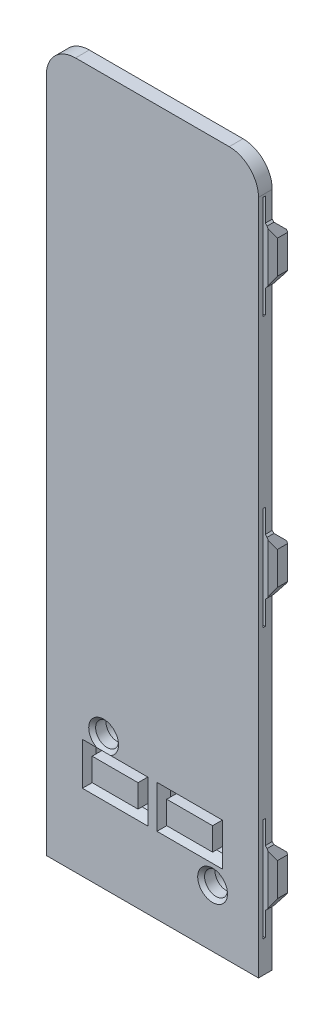
from build123d import *
from OCP.BRepFilletAPI import BRepFilletAPI_MakeChamfer

# Parameters (mm, degrees)
AUFSATZ_LINEAR_AUSTRAGEN1_DEPTH      = 1.2
SKIZZE3_W                            = 1.2
SKIZZE3_H                            = 9
SCHNITT_LINEAR_AUSTRAGEN1_DEPTH      = 0.8
SCHNITT_LINEAR_AUSTRAGEN2_REACH      = 46.284
SKIZZE4_W                            = 0.2
SKIZZE4_H                            = 9
AUFSATZ_LINEAR_AUSTRAGEN2_DEPTH      = 0.7
AUFSATZ_LINEAR_AUSTRAGEN2_DEPTH_BACK = 0.6
SKIZZE5_W                            = 1.85
SKIZZE5_H                            = 4.6
FASE3_SIZE                           = 0.4
FASE1_SIZE                           = 0.5
FASE1_SIZE2                          = 0.866025404
FASE4_SIZE                           = 0.7
FASE5_SIZE                           = 0.15
SKIZZE6_R                            = 1
SCHNITT_LINEAR_AUSTRAGEN3_DEPTH      = 90.774735305
SKIZZE7_W                            = 4
SKIZZE7_H                            = 2
AUFSATZ_LINEAR_AUSTRAGEN3_DEPTH      = 2.8
SKIZZE8_W                            = 4.5
SKIZZE8_H                            = 2.5
SKIZZE8_W_2                          = 4
SKIZZE8_H_2                          = 2
SCHNITT_LINEAR_AUSTRAGEN4_DEPTH      = 90.798291181
SKIZZE16_R                           = 1.5
SKIZZE16_R_2                         = 1.125
AUFSATZ_LINEAR_AUSTRAGEN8_DEPTH      = 2
SKIZZE17_W                           = 0.9
SKIZZE17_H                           = 5
AUFSATZ_LINEAR_AUSTRAGEN9_DEPTH      = 0.3
SKIZZE18_W                           = 0.9
SKIZZE18_H                           = 1
AUFSATZ_LINEAR_AUSTRAGEN10_DEPTH     = 0.5
FASE6_SIZE                           = 0.5
FASE7_SIZE                           = 0.3
FASE8_SIZE                           = 0.3
FASE9_SIZE                           = 0.6


# Some blends are built 0.0001 mm under size
with BuildPart() as part:
    # Skizze2 → Aufsatz-Linear austragen1 (new body)
    with BuildSketch(Plane.XY.offset(4.5)):
        with BuildLine():
            Line((-63.757544371, 39.98197296), (-77.157544371, 39.98197296))
            ThreePointArc((-77.157544371, 39.98197296), (-78.960666663, 39.235095252), (-79.707544371, 37.43197296))
            Line((-79.707544371, 37.43197296), (-79.707544371, -21.51802704))
            Line((-79.707544371, -21.51802704), (-61.207544371, -21.51802704))
            Line((-61.207544371, -21.51802704), (-61.207544371, 37.43197296))
            ThreePointArc((-61.207544371, 37.43197296), (-61.954422079, 39.235095252), (-63.757544371, 39.98197296))
        make_face()
    extrude(amount=-AUFSATZ_LINEAR_AUSTRAGEN1_DEPTH)

    # Skizze3 → Schnitt-Linear austragen1 (cut)
    with BuildSketch(Plane(origin=(0, 0, 3.3), x_dir=(-1, 0, 0), z_dir=(0, 0, -1))):
        with Locations((63.007544371, 32.73197296)):
            Rectangle(SKIZZE3_W, SKIZZE3_H)
        with Locations((63.007544371, 9.23197296)):
            Rectangle(SKIZZE3_W, SKIZZE3_H)
        with Locations((63.007544371, -14.26802704)):
            Rectangle(SKIZZE3_W, SKIZZE3_H)
        with Locations((77.907544371, -14.26802704)):
            Rectangle(SKIZZE3_W, SKIZZE3_H)
        with Locations((77.907544371, 9.23197296)):
            Rectangle(SKIZZE3_W, SKIZZE3_H)
        with Locations((77.907544371, 32.73197296)):
            Rectangle(SKIZZE3_W, SKIZZE3_H)
    extrude(amount=-SCHNITT_LINEAR_AUSTRAGEN1_DEPTH, mode=Mode.SUBTRACT)

    # Skizze4 → Schnitt-Linear austragen2 (cut, up to next)
    with BuildSketch(Plane(origin=(-61.207544371, 0, 0), x_dir=(0, 0, -1), z_dir=(1, 0, 0)), mode=Mode.PRIVATE) as schnitt_linear_austragen2_sk1:
        with Locations((-4, 32.73197296)):
            Rectangle(SKIZZE4_W, SKIZZE4_H)
    schnitt_linear_austragen2_tool1 = extrude(schnitt_linear_austragen2_sk1.sketch, amount=-SCHNITT_LINEAR_AUSTRAGEN2_REACH, mode=Mode.PRIVATE) & part.part
    # Skizze4 → Schnitt-Linear austragen2 (cut, up to next)
    with BuildSketch(Plane(origin=(-61.207544371, 0, 0), x_dir=(0, 0, -1), z_dir=(1, 0, 0)), mode=Mode.PRIVATE) as schnitt_linear_austragen2_sk2:
        with Locations((-4, 9.23197296)):
            Rectangle(SKIZZE4_W, SKIZZE4_H)
    schnitt_linear_austragen2_tool2 = extrude(schnitt_linear_austragen2_sk2.sketch, amount=-SCHNITT_LINEAR_AUSTRAGEN2_REACH, mode=Mode.PRIVATE) & part.part
    # Skizze4 → Schnitt-Linear austragen2 (cut, up to next)
    with BuildSketch(Plane(origin=(-61.207544371, 0, 0), x_dir=(0, 0, -1), z_dir=(1, 0, 0)), mode=Mode.PRIVATE) as schnitt_linear_austragen2_sk3:
        with Locations((-4, -14.26802704)):
            Rectangle(SKIZZE4_W, SKIZZE4_H)
    schnitt_linear_austragen2_tool3 = extrude(schnitt_linear_austragen2_sk3.sketch, amount=-SCHNITT_LINEAR_AUSTRAGEN2_REACH, mode=Mode.PRIVATE) & part.part
    schnitt_linear_austragen2_1 = schnitt_linear_austragen2_tool1.solids().sort_by_distance((-61.207544, 32.731973, 4))[0]
    add(schnitt_linear_austragen2_1, mode=Mode.SUBTRACT)
    schnitt_linear_austragen2_2 = schnitt_linear_austragen2_tool2.solids().sort_by_distance((-61.207544, 9.231973, 4))[0]
    add(schnitt_linear_austragen2_2, mode=Mode.SUBTRACT)
    schnitt_linear_austragen2_3 = schnitt_linear_austragen2_tool3.solids().sort_by_distance((-61.207544, -14.268027, 4))[0]
    add(schnitt_linear_austragen2_3, mode=Mode.SUBTRACT)
    schnitt_linear_austragen2 = schnitt_linear_austragen2_1 + schnitt_linear_austragen2_2 + schnitt_linear_austragen2_3  # Schnitt-Linear austragen2 as one shape, for the pattern or mirror that repeats it

    # Spiegeln1: Schnitt-Linear austragen2 across plane
    add(schnitt_linear_austragen2.mirror(Plane.ZY.offset(70.457544371)), mode=Mode.SUBTRACT)

    # Skizze5 → Aufsatz-Linear austragen2 (add, two sides: drawn at the far end of the back side and taken through both)
    with BuildSketch(Plane(origin=(0, 0, 3.3), x_dir=(-1, 0, 0), z_dir=(0, 0, -1)).offset(-AUFSATZ_LINEAR_AUSTRAGEN2_DEPTH_BACK)):
        with Locations((61.482544371, 32.73197296)):
            Rectangle(SKIZZE5_W, SKIZZE5_H)
        with Locations((61.482544371, 9.23197296)):
            Rectangle(SKIZZE5_W, SKIZZE5_H)
        with Locations((61.482544371, -14.26802704)):
            Rectangle(SKIZZE5_W, SKIZZE5_H)
        with Locations((79.432544371, -14.26802704)):
            Rectangle(SKIZZE5_W, SKIZZE5_H)
        with Locations((79.432544371, 9.23197296)):
            Rectangle(SKIZZE5_W, SKIZZE5_H)
        with Locations((79.432544371, 32.73197296)):
            Rectangle(SKIZZE5_W, SKIZZE5_H)
    extrude(amount=AUFSATZ_LINEAR_AUSTRAGEN2_DEPTH + AUFSATZ_LINEAR_AUSTRAGEN2_DEPTH_BACK)

    # Fase3
    fase3_edges = [part.edges().sort_by_distance(p)[0] for p in [
        (-60.557544371, 32.73197296, 3.9),
        (-60.557544371, 9.23197296, 3.9),
        (-60.557544371, -14.26802704, 3.9),
        (-80.357544371, -14.26802704, 3.9),
        (-80.357544371, 9.23197296, 3.9),
        (-80.357544371, 32.73197296, 3.9),
    ]]
    chamfer(fase3_edges, length=FASE3_SIZE)

    # Fase1: one chamfer whose edges measure the first distance from different faces: ONE call of the kernel's chamfer builder (chamfer() names one face for all edges)
    fase1_edges_1 = [part.edges().sort_by_distance(p)[0] for p in [
        (-60.557544371, -11.96802704, 3.05),
    ]]
    fase1_side_1 = [part.faces().sort_by_distance(p)[0] for p in [
        (-61.376209999, -11.96802704, 3.067237799),
    ]]
    fase1_edges_2 = [part.edges().sort_by_distance(p)[0] for p in [
        (-80.357544371, -16.56802704, 3.05),
    ]]
    fase1_side_2 = [part.faces().sort_by_distance(p)[0] for p in [
        (-79.538878743, -16.56802704, 3.067237799),
    ]]
    fase1_edges_3 = [part.edges().sort_by_distance(p)[0] for p in [
        (-80.357544371, 6.93197296, 3.05),
    ]]
    fase1_side_3 = [part.faces().sort_by_distance(p)[0] for p in [
        (-79.538878743, 6.93197296, 3.067237799),
    ]]
    fase1_edges_4 = [part.edges().sort_by_distance(p)[0] for p in [
        (-60.557544371, 11.53197296, 3.05),
    ]]
    fase1_side_4 = [part.faces().sort_by_distance(p)[0] for p in [
        (-61.376209999, 11.53197296, 3.067237799),
    ]]
    fase1_edges_5 = [part.edges().sort_by_distance(p)[0] for p in [
        (-60.557544371, -16.56802704, 3.05),
    ]]
    fase1_side_5 = [part.faces().sort_by_distance(p)[0] for p in [
        (-61.376209999, -16.56802704, 3.067237799),
    ]]
    fase1_edges_6 = [part.edges().sort_by_distance(p)[0] for p in [
        (-80.357544371, -11.96802704, 3.05),
    ]]
    fase1_side_6 = [part.faces().sort_by_distance(p)[0] for p in [
        (-79.538878743, -11.96802704, 3.067237799),
    ]]
    fase1_edges_7 = [part.edges().sort_by_distance(p)[0] for p in [
        (-60.557544371, 6.93197296, 3.05),
    ]]
    fase1_side_7 = [part.faces().sort_by_distance(p)[0] for p in [
        (-61.376209999, 6.93197296, 3.067237799),
    ]]
    fase1_edges_8 = [part.edges().sort_by_distance(p)[0] for p in [
        (-80.357544371, 11.53197296, 3.05),
    ]]
    fase1_side_8 = [part.faces().sort_by_distance(p)[0] for p in [
        (-79.538878743, 11.53197296, 3.067237799),
    ]]
    fase1_edges_9 = [part.edges().sort_by_distance(p)[0] for p in [
        (-80.357544371, 35.03197296, 3.05),
    ]]
    fase1_side_9 = [part.faces().sort_by_distance(p)[0] for p in [
        (-79.538878743, 35.03197296, 3.067237799),
    ]]
    fase1_edges_10 = [part.edges().sort_by_distance(p)[0] for p in [
        (-80.357544371, 30.43197296, 3.05),
    ]]
    fase1_side_10 = [part.faces().sort_by_distance(p)[0] for p in [
        (-79.538878743, 30.43197296, 3.067237799),
    ]]
    fase1_edges_11 = [part.edges().sort_by_distance(p)[0] for p in [
        (-60.557544371, 30.43197296, 3.05),
    ]]
    fase1_side_11 = [part.faces().sort_by_distance(p)[0] for p in [
        (-61.376209999, 30.43197296, 3.067237799),
    ]]
    fase1_edges_12 = [part.edges().sort_by_distance(p)[0] for p in [
        (-60.557544371, 35.03197296, 3.05),
    ]]
    fase1_side_12 = [part.faces().sort_by_distance(p)[0] for p in [
        (-61.376209999, 35.03197296, 3.067237799),
    ]]
    fase1 = BRepFilletAPI_MakeChamfer(part.part.solid().wrapped)
    for e in fase1_edges_1:
        fase1.Add(FASE1_SIZE, FASE1_SIZE2, e.wrapped, fase1_side_1[0].wrapped)  # the first distance lies on this face
    for e in fase1_edges_2:
        fase1.Add(FASE1_SIZE, FASE1_SIZE2, e.wrapped, fase1_side_2[0].wrapped)  # the first distance lies on this face
    for e in fase1_edges_3:
        fase1.Add(FASE1_SIZE, FASE1_SIZE2, e.wrapped, fase1_side_3[0].wrapped)  # the first distance lies on this face
    for e in fase1_edges_4:
        fase1.Add(FASE1_SIZE, FASE1_SIZE2, e.wrapped, fase1_side_4[0].wrapped)  # the first distance lies on this face
    for e in fase1_edges_5:
        fase1.Add(FASE1_SIZE, FASE1_SIZE2, e.wrapped, fase1_side_5[0].wrapped)  # the first distance lies on this face
    for e in fase1_edges_6:
        fase1.Add(FASE1_SIZE, FASE1_SIZE2, e.wrapped, fase1_side_6[0].wrapped)  # the first distance lies on this face
    for e in fase1_edges_7:
        fase1.Add(FASE1_SIZE, FASE1_SIZE2, e.wrapped, fase1_side_7[0].wrapped)  # the first distance lies on this face
    for e in fase1_edges_8:
        fase1.Add(FASE1_SIZE, FASE1_SIZE2, e.wrapped, fase1_side_8[0].wrapped)  # the first distance lies on this face
    for e in fase1_edges_9:
        fase1.Add(FASE1_SIZE, FASE1_SIZE2, e.wrapped, fase1_side_9[0].wrapped)  # the first distance lies on this face
    for e in fase1_edges_10:
        fase1.Add(FASE1_SIZE, FASE1_SIZE2, e.wrapped, fase1_side_10[0].wrapped)  # the first distance lies on this face
    for e in fase1_edges_11:
        fase1.Add(FASE1_SIZE, FASE1_SIZE2, e.wrapped, fase1_side_11[0].wrapped)  # the first distance lies on this face
    for e in fase1_edges_12:
        fase1.Add(FASE1_SIZE, FASE1_SIZE2, e.wrapped, fase1_side_12[0].wrapped)  # the first distance lies on this face
    add(Compound.cast(fase1.Shape()), mode=Mode.REPLACE)

    # Fase4
    fase4_edges = [part.edges().sort_by_distance(p)[0] for p in [
        (-79.182544371, -16.56802704, 2.6),
        (-78.507544371, -14.26802704, 2.6),
        (-79.182544371, -11.96802704, 2.6),
        (-61.732544371, -16.56802704, 2.6),
        (-62.407544371, -14.26802704, 2.6),
        (-61.732544371, -11.96802704, 2.6),
        (-61.732544371, 6.93197296, 2.6),
        (-62.407544371, 9.23197296, 2.6),
        (-61.732544371, 11.53197296, 2.6),
        (-79.182544371, 11.53197296, 2.6),
        (-78.507544371, 9.23197296, 2.6),
        (-79.182544371, 6.93197296, 2.6),
        (-79.182544371, 35.03197296, 2.6),
        (-78.507544371, 32.73197296, 2.6),
        (-79.182544371, 30.43197296, 2.6),
        (-61.732544371, 35.03197296, 2.6),
        (-62.407544371, 32.73197296, 2.6),
        (-61.732544371, 30.43197296, 2.6),
    ]]
    chamfer(fase4_edges, length=FASE4_SIZE - 0.0001)  # a hair under: the kernel refuses the full size

    # Fase5
    fase5_edges = [part.edges().sort_by_distance(p)[0] for p in [
        (-79.707544371, 35.03197296, 3.6),
        (-79.707544371, 30.43197296, 3.6),
        (-79.707544371, 6.93197296, 3.6),
        (-79.707544371, 11.53197296, 3.6),
        (-79.707544371, -11.96802704, 3.6),
        (-79.707544371, -16.56802704, 3.6),
        (-61.207544371, -16.56802704, 3.6),
        (-61.207544371, -11.96802704, 3.6),
        (-61.207544371, 11.53197296, 3.6),
        (-61.207544371, 6.93197296, 3.6),
        (-61.207544371, 30.43197296, 3.6),
        (-61.207544371, 35.03197296, 3.6),
    ]]
    chamfer(fase5_edges, length=FASE5_SIZE - 0.0001)  # a hair under: the kernel refuses the full size

    # Skizze6 → Schnitt-Linear austragen3 (cut, through all)
    with BuildSketch(Plane.XY.offset(4.5)):
        with Locations((-65.207544371, -16.51802704)):
            Circle(SKIZZE6_R)
        with Locations((-74.707544371, -10.01802704)):
            Circle(SKIZZE6_R)
    extrude(amount=-SCHNITT_LINEAR_AUSTRAGEN3_DEPTH, mode=Mode.SUBTRACT)

    # Skizze7 → Aufsatz-Linear austragen3 (add)
    with BuildSketch(Plane(origin=(0, 0, 3.3), x_dir=(-1, 0, 0), z_dir=(0, 0, -1))):
        with Locations((73.707544371, -13.01802704)):
            Rectangle(SKIZZE7_W, SKIZZE7_H)
        with Locations((67.207544371, -13.01802704)):
            Rectangle(SKIZZE7_W, SKIZZE7_H)
    extrude(amount=AUFSATZ_LINEAR_AUSTRAGEN3_DEPTH)

    # Skizze8 → Schnitt-Linear austragen4 (cut, through all)
    # profile 1 of 2: a face of its own
    with BuildSketch(Plane(origin=(0, 0, 3.3), x_dir=(-1, 0, 0), z_dir=(0, 0, -1))):
        with Locations((67.207544371, -13.01802704)):
            Rectangle(SKIZZE8_W, SKIZZE8_H)
        with Locations((67.207544371, -13.01802704)):
            Rectangle(SKIZZE8_W_2, SKIZZE8_H_2, mode=Mode.SUBTRACT)
    # profile 2 of 2: a face of its own
    with BuildSketch(Plane(origin=(0, 0, 3.3), x_dir=(-1, 0, 0), z_dir=(0, 0, -1))):
        with Locations((73.707544371, -13.01802704)):
            Rectangle(SKIZZE8_W, SKIZZE8_H)
        with Locations((73.707544371, -13.01802704)):
            Rectangle(SKIZZE8_W_2, SKIZZE8_H_2, mode=Mode.SUBTRACT)
    extrude(amount=-SCHNITT_LINEAR_AUSTRAGEN4_DEPTH, mode=Mode.SUBTRACT)


with BuildPart() as schnitt_linear_austragen4_piece_1:
    # of the separate pieces the step leaves, piece 1, a body of its own (schnitt_linear_austragen4_pieces)
    add(part.part.solids().sort_by_distance((-79.857444371, 35.03197296, 3.9))[0])

    # Skizze16 → Aufsatz-Linear austragen8 (add)
    # profile 1 of 2: a face of its own
    with BuildSketch(Plane(origin=(0, 0, 3.3), x_dir=(-1, 0, 0), z_dir=(0, 0, -1))):
        with Locations(Location((65.207544371, -16.51802704, 0), (0, 0, 180))):
            Circle(SKIZZE16_R)
        with Locations((65.207544371, -16.51802704)):
            Circle(SKIZZE16_R_2, mode=Mode.SUBTRACT)
    # profile 2 of 2: a face of its own
    with BuildSketch(Plane(origin=(0, 0, 3.3), x_dir=(-1, 0, 0), z_dir=(0, 0, -1))):
        with Locations(Location((74.707544371, -10.01802704, 0), (0, 0, 180))):
            Circle(SKIZZE16_R)
        with Locations((74.707544371, -10.01802704)):
            Circle(SKIZZE16_R_2, mode=Mode.SUBTRACT)
    extrude(amount=AUFSATZ_LINEAR_AUSTRAGEN8_DEPTH)



with BuildPart() as schnitt_linear_austragen4_piece_2:
    # of the separate pieces the step leaves, piece 2, a body of its own (schnitt_linear_austragen4_pieces)
    add(part.part.solids().sort_by_distance((-71.707544371, -12.01802704, 0.5))[0])



with BuildPart() as schnitt_linear_austragen4_piece_3:
    # of the separate pieces the step leaves, piece 3, a body of its own (schnitt_linear_austragen4_pieces)
    add(part.part.solids().sort_by_distance((-69.207544371, -12.01802704, 0.5))[0])


with BuildPart() as schnitt_linear_austragen4_piece_2_1:
    add(schnitt_linear_austragen4_piece_2.part)

    add(schnitt_linear_austragen4_piece_3.part)  # Aufsatz-Linear austragen9 merges Schnitt-Linear austragen4 piece 3
    # Skizze17 → Aufsatz-Linear austragen9 (add)
    with BuildSketch(Plane(origin=(0, 0, 2.8), x_dir=(-1, 0, 0), z_dir=(0, 0, -1))):
        with Locations((72.157544371, -9.51802704)):
            Rectangle(SKIZZE17_W, SKIZZE17_H)
        with Locations((75.257544371, -16.51802704)):
            Rectangle(SKIZZE17_W, SKIZZE17_H)
        with Locations((65.657544371, -9.51802704)):
            Rectangle(SKIZZE17_W, SKIZZE17_H)
        with Locations((68.757544371, -16.51802704)):
            Rectangle(SKIZZE17_W, SKIZZE17_H)
    extrude(amount=AUFSATZ_LINEAR_AUSTRAGEN9_DEPTH)


with BuildPart() as schnitt_linear_austragen4_piece_1_1:
    add(schnitt_linear_austragen4_piece_1.part)

    add(schnitt_linear_austragen4_piece_2_1.part)  # Aufsatz-Linear austragen10 merges Schnitt-Linear austragen4 piece 2
    # Skizze18 → Aufsatz-Linear austragen10 (add)
    with BuildSketch(Plane(origin=(0, 0, 3.3), x_dir=(-1, 0, 0), z_dir=(0, 0, -1))):
        with Locations((65.657544371, -7.51802704)):
            Rectangle(SKIZZE18_W, SKIZZE18_H)
        with Locations((72.157544371, -7.51802704)):
            Rectangle(SKIZZE18_W, SKIZZE18_H)
        with Locations((68.757544371, -18.51802704)):
            Rectangle(SKIZZE18_W, SKIZZE18_H)
        with Locations((75.257544371, -18.51802704)):
            Rectangle(SKIZZE18_W, SKIZZE18_H)
    extrude(amount=AUFSATZ_LINEAR_AUSTRAGEN10_DEPTH)

    # Fase6
    fase6_edges = [schnitt_linear_austragen4_piece_1_1.edges().sort_by_distance(p)[0] for p in [
        (-66.107544371, -7.51802704, 3.3),
        (-65.657544371, -7.01802704, 3.3),
        (-65.207544371, -7.51802704, 3.3),
        (-65.657544371, -8.01802704, 3.3),
        (-72.607544371, -7.51802704, 3.3),
        (-72.157544371, -7.01802704, 3.3),
        (-71.707544371, -7.51802704, 3.3),
        (-72.157544371, -8.01802704, 3.3),
        (-75.707544371, -18.51802704, 3.3),
        (-75.257544371, -18.01802704, 3.3),
        (-74.807544371, -18.51802704, 3.3),
        (-75.257544371, -19.01802704, 3.3),
        (-69.207544371, -18.51802704, 3.3),
        (-68.757544371, -18.01802704, 3.3),
        (-68.307544371, -18.51802704, 3.3),
        (-68.757544371, -19.01802704, 3.3),
    ]]
    chamfer(fase6_edges, length=FASE6_SIZE - 0.0001)  # a hair under: the kernel refuses the full size

    # Fase7
    fase7_edges = [schnitt_linear_austragen4_piece_1_1.edges().sort_by_distance(p)[0] for p in [
        (-65.657544371, -7.01802704, 2.5),
        (-72.157544371, -7.01802704, 2.5),
        (-75.257544371, -19.01802704, 2.5),
        (-68.757544371, -19.01802704, 2.5),
    ]]
    chamfer(fase7_edges, length=FASE7_SIZE)

    # Fase8
    fase8_edges = [schnitt_linear_austragen4_piece_1_1.edges().sort_by_distance(p)[0] for p in [
        (-64.082544371, -16.51802704, 1.3),
        (-73.582544371, -10.01802704, 1.3),
        (-75.707544371, -10.01802704, 4.5),
        (-66.207544371, -16.51802704, 4.5),
    ]]
    chamfer(fase8_edges, length=FASE8_SIZE)

    # Fase9
    # the kernel refuses this chamfer: 0.6 mm, written as the material it takes off along each edge
    with BuildSketch(Plane(origin=(-64.957544371, -11.76802704, 4.5), x_dir=(0, 0.9996219169112968, 0.027495876610585824), z_dir=(-1, 0, 0)), Plane(origin=(-75.957544371, -14.26802704, 4.5), x_dir=(0, -0.9996219169112968, 0.027495876610585824), z_dir=(1, 0, 0)), Plane(origin=(-71.457544371, -11.76802704, 4.5), x_dir=(0, 0.9996219169112968, 0.027495876610585824), z_dir=(-1, 0, 0)), Plane(origin=(-69.457544371, -14.26802704, 4.5), x_dir=(0, -0.9996219169112968, 0.027495876610585824), z_dir=(1, 0, 0))) as fase9_piece_1:
        Polygon((FASE9_SIZE * 0.999621916911, FASE9_SIZE * 0.0274958766106), (-FASE9_SIZE * 0.0274958766106, FASE9_SIZE * 0.999621916911), (0, 0), align=None)
    extrude(amount=4.5, mode=Mode.SUBTRACT)
    with BuildSketch(Plane(origin=(-64.957544371, -14.26802704, 4.5), x_dir=(0.9996219169112968, 0, 0.027495876610585904), z_dir=(0, 1, 0)), Plane(origin=(-75.957544371, -11.76802704, 4.5), x_dir=(-0.9996219169112968, 0, 0.027495876610585904), z_dir=(0, -1, 0)), Plane(origin=(-71.457544371, -14.26802704, 4.5), x_dir=(0.9996219169112968, 0, 0.027495876610585904), z_dir=(0, 1, 0)), Plane(origin=(-69.457544371, -11.76802704, 4.5), x_dir=(-0.9996219169112968, 0, 0.027495876610585904), z_dir=(0, -1, 0))) as fase9_piece_2:
        Polygon((FASE9_SIZE * 0.999621916911, FASE9_SIZE * 0.0274958766106), (-FASE9_SIZE * 0.0274958766106, FASE9_SIZE * 0.999621916911), (0, 0), align=None)
    extrude(amount=2.5, mode=Mode.SUBTRACT)
    with BuildSketch(Plane(origin=(-64.957544371, -14.26802704, 4.5), x_dir=(0.9996219169112968, 0, 0.027495876610585904), z_dir=(0, 1, 0))) as fase9_piece_3a_section:
        Polygon((FASE9_SIZE * 0.999621916911, FASE9_SIZE * 0.0274958766106), (-FASE9_SIZE * 0.0274958766106, FASE9_SIZE * 0.999621916911), (0, 0), align=None)
    fase9_piece_3a = extrude(amount=4.043009793, mode=Mode.PRIVATE)
    fase9_piece_3a = split(fase9_piece_3a, bisect_by=Plane(origin=(-64.759668195, -11.76802704, 4.302123824), z_dir=(0, 1, 0)), keep=Keep.TOP, mode=Mode.PRIVATE)
    with BuildSketch(Plane(origin=(-63.414534578, -11.76802704, 4.5), x_dir=(0, 0.9996219169112968, 0.027495876610585824), z_dir=(-1, 0, 0))) as fase9_piece_3b_section:
        Polygon((FASE9_SIZE * 0.999621916911, FASE9_SIZE * 0.0274958766106), (-FASE9_SIZE * 0.0274958766106, FASE9_SIZE * 0.999621916911), (0, 0), align=None)
    fase9_piece_3b = extrude(amount=6.043009793, mode=Mode.PRIVATE)
    fase9_piece_3b = split(fase9_piece_3b, bisect_by=Plane(origin=(-64.957544371, -11.570150864, 4.302123824), z_dir=(1, 0, 0)), keep=Keep.TOP, mode=Mode.PRIVATE)
    fase9_piece_3 = fase9_piece_3a & fase9_piece_3b
    add(fase9_piece_3, mode=Mode.SUBTRACT)
    with BuildSketch(Plane(origin=(-69.457544371, -10.225017247, 4.5), x_dir=(-0.9996219169112968, 0, 0.027495876610585904), z_dir=(0, -1, 0))) as fase9_piece_4a_section:
        Polygon((FASE9_SIZE * 0.999621916911, FASE9_SIZE * 0.0274958766106), (-FASE9_SIZE * 0.0274958766106, FASE9_SIZE * 0.999621916911), (0, 0), align=None)
    fase9_piece_4a = extrude(amount=4.043009793, mode=Mode.PRIVATE)
    fase9_piece_4a = split(fase9_piece_4a, bisect_by=Plane(origin=(-69.655420547, -11.76802704, 4.302123824), z_dir=(0, 1, 0)), keep=Keep.TOP, mode=Mode.PRIVATE)
    with BuildSketch(Plane(origin=(-64.957544371, -11.76802704, 4.5), x_dir=(0, 0.9996219169112968, 0.027495876610585824), z_dir=(-1, 0, 0))) as fase9_piece_4b_section:
        Polygon((FASE9_SIZE * 0.999621916911, FASE9_SIZE * 0.0274958766106), (-FASE9_SIZE * 0.0274958766106, FASE9_SIZE * 0.999621916911), (0, 0), align=None)
    fase9_piece_4b = extrude(amount=6.043009793, mode=Mode.PRIVATE)
    fase9_piece_4b = split(fase9_piece_4b, bisect_by=Plane(origin=(-69.457544371, -11.570150864, 4.302123824), z_dir=(-1, 0, 0)), keep=Keep.TOP, mode=Mode.PRIVATE)
    fase9_piece_4 = fase9_piece_4a & fase9_piece_4b
    add(fase9_piece_4, mode=Mode.SUBTRACT)
    with BuildSketch(Plane(origin=(-69.457544371, -14.26802704, 4.5), x_dir=(0, -0.9996219169112968, 0.027495876610585824), z_dir=(1, 0, 0))) as fase9_piece_5a_section:
        Polygon((FASE9_SIZE * 0.999621916911, FASE9_SIZE * 0.0274958766106), (-FASE9_SIZE * 0.0274958766106, FASE9_SIZE * 0.999621916911), (0, 0), align=None)
    fase9_piece_5a = extrude(amount=6.043009793, mode=Mode.PRIVATE)
    fase9_piece_5a = split(fase9_piece_5a, bisect_by=Plane(origin=(-64.957544371, -14.465903216, 4.302123824), z_dir=(1, 0, 0)), keep=Keep.TOP, mode=Mode.PRIVATE)
    with BuildSketch(Plane(origin=(-64.957544371, -15.811036833, 4.5), x_dir=(0.9996219169112968, 0, 0.027495876610585904), z_dir=(0, 1, 0))) as fase9_piece_5b_section:
        Polygon((FASE9_SIZE * 0.999621916911, FASE9_SIZE * 0.0274958766106), (-FASE9_SIZE * 0.0274958766106, FASE9_SIZE * 0.999621916911), (0, 0), align=None)
    fase9_piece_5b = extrude(amount=4.043009793, mode=Mode.PRIVATE)
    fase9_piece_5b = split(fase9_piece_5b, bisect_by=Plane(origin=(-64.759668195, -14.26802704, 4.302123824), z_dir=(0, -1, 0)), keep=Keep.TOP, mode=Mode.PRIVATE)
    fase9_piece_5 = fase9_piece_5a & fase9_piece_5b
    add(fase9_piece_5, mode=Mode.SUBTRACT)
    with BuildSketch(Plane(origin=(-75.957544371, -11.76802704, 4.5), x_dir=(-0.9996219169112968, 0, 0.027495876610585904), z_dir=(0, -1, 0))) as fase9_piece_6a_section:
        Polygon((FASE9_SIZE * 0.999621916911, FASE9_SIZE * 0.0274958766106), (-FASE9_SIZE * 0.0274958766106, FASE9_SIZE * 0.999621916911), (0, 0), align=None)
    fase9_piece_6a = extrude(amount=4.043009793, mode=Mode.PRIVATE)
    fase9_piece_6a = split(fase9_piece_6a, bisect_by=Plane(origin=(-76.155420547, -14.26802704, 4.302123824), z_dir=(0, -1, 0)), keep=Keep.TOP, mode=Mode.PRIVATE)
    with BuildSketch(Plane(origin=(-77.500554164, -14.26802704, 4.5), x_dir=(0, -0.9996219169112968, 0.027495876610585824), z_dir=(1, 0, 0))) as fase9_piece_6b_section:
        Polygon((FASE9_SIZE * 0.999621916911, FASE9_SIZE * 0.0274958766106), (-FASE9_SIZE * 0.0274958766106, FASE9_SIZE * 0.999621916911), (0, 0), align=None)
    fase9_piece_6b = extrude(amount=6.043009793, mode=Mode.PRIVATE)
    fase9_piece_6b = split(fase9_piece_6b, bisect_by=Plane(origin=(-75.957544371, -14.465903216, 4.302123824), z_dir=(-1, 0, 0)), keep=Keep.TOP, mode=Mode.PRIVATE)
    fase9_piece_6 = fase9_piece_6a & fase9_piece_6b
    add(fase9_piece_6, mode=Mode.SUBTRACT)
    with BuildSketch(Plane(origin=(-75.957544371, -14.26802704, 4.5), x_dir=(0, -0.9996219169112968, 0.027495876610585824), z_dir=(1, 0, 0))) as fase9_piece_7a_section:
        Polygon((FASE9_SIZE * 0.999621916911, FASE9_SIZE * 0.0274958766106), (-FASE9_SIZE * 0.0274958766106, FASE9_SIZE * 0.999621916911), (0, 0), align=None)
    fase9_piece_7a = extrude(amount=6.043009793, mode=Mode.PRIVATE)
    fase9_piece_7a = split(fase9_piece_7a, bisect_by=Plane(origin=(-71.457544371, -14.465903216, 4.302123824), z_dir=(1, 0, 0)), keep=Keep.TOP, mode=Mode.PRIVATE)
    with BuildSketch(Plane(origin=(-71.457544371, -15.811036833, 4.5), x_dir=(0.9996219169112968, 0, 0.027495876610585904), z_dir=(0, 1, 0))) as fase9_piece_7b_section:
        Polygon((FASE9_SIZE * 0.999621916911, FASE9_SIZE * 0.0274958766106), (-FASE9_SIZE * 0.0274958766106, FASE9_SIZE * 0.999621916911), (0, 0), align=None)
    fase9_piece_7b = extrude(amount=4.043009793, mode=Mode.PRIVATE)
    fase9_piece_7b = split(fase9_piece_7b, bisect_by=Plane(origin=(-71.259668195, -14.26802704, 4.302123824), z_dir=(0, -1, 0)), keep=Keep.TOP, mode=Mode.PRIVATE)
    fase9_piece_7 = fase9_piece_7a & fase9_piece_7b
    add(fase9_piece_7, mode=Mode.SUBTRACT)
    with BuildSketch(Plane(origin=(-75.957544371, -10.225017247, 4.5), x_dir=(-0.9996219169112968, 0, 0.027495876610585904), z_dir=(0, -1, 0))) as fase9_piece_8a_section:
        Polygon((FASE9_SIZE * 0.999621916911, FASE9_SIZE * 0.0274958766106), (-FASE9_SIZE * 0.0274958766106, FASE9_SIZE * 0.999621916911), (0, 0), align=None)
    fase9_piece_8a = extrude(amount=4.043009793, mode=Mode.PRIVATE)
    fase9_piece_8a = split(fase9_piece_8a, bisect_by=Plane(origin=(-76.155420547, -11.76802704, 4.302123824), z_dir=(0, 1, 0)), keep=Keep.TOP, mode=Mode.PRIVATE)
    with BuildSketch(Plane(origin=(-71.457544371, -11.76802704, 4.5), x_dir=(0, 0.9996219169112968, 0.027495876610585824), z_dir=(-1, 0, 0))) as fase9_piece_8b_section:
        Polygon((FASE9_SIZE * 0.999621916911, FASE9_SIZE * 0.0274958766106), (-FASE9_SIZE * 0.0274958766106, FASE9_SIZE * 0.999621916911), (0, 0), align=None)
    fase9_piece_8b = extrude(amount=6.043009793, mode=Mode.PRIVATE)
    fase9_piece_8b = split(fase9_piece_8b, bisect_by=Plane(origin=(-75.957544371, -11.570150864, 4.302123824), z_dir=(-1, 0, 0)), keep=Keep.TOP, mode=Mode.PRIVATE)
    fase9_piece_8 = fase9_piece_8a & fase9_piece_8b
    add(fase9_piece_8, mode=Mode.SUBTRACT)
    with BuildSketch(Plane(origin=(-71.457544371, -14.26802704, 4.5), x_dir=(0.9996219169112968, 0, 0.027495876610585904), z_dir=(0, 1, 0))) as fase9_piece_9a_section:
        Polygon((FASE9_SIZE * 0.999621916911, FASE9_SIZE * 0.0274958766106), (-FASE9_SIZE * 0.0274958766106, FASE9_SIZE * 0.999621916911), (0, 0), align=None)
    fase9_piece_9a = extrude(amount=4.043009793, mode=Mode.PRIVATE)
    fase9_piece_9a = split(fase9_piece_9a, bisect_by=Plane(origin=(-71.259668195, -11.76802704, 4.302123824), z_dir=(0, 1, 0)), keep=Keep.TOP, mode=Mode.PRIVATE)
    with BuildSketch(Plane(origin=(-69.914534578, -11.76802704, 4.5), x_dir=(0, 0.9996219169112968, 0.027495876610585824), z_dir=(-1, 0, 0))) as fase9_piece_9b_section:
        Polygon((FASE9_SIZE * 0.999621916911, FASE9_SIZE * 0.0274958766106), (-FASE9_SIZE * 0.0274958766106, FASE9_SIZE * 0.999621916911), (0, 0), align=None)
    fase9_piece_9b = extrude(amount=6.043009793, mode=Mode.PRIVATE)
    fase9_piece_9b = split(fase9_piece_9b, bisect_by=Plane(origin=(-71.457544371, -11.570150864, 4.302123824), z_dir=(1, 0, 0)), keep=Keep.TOP, mode=Mode.PRIVATE)
    fase9_piece_9 = fase9_piece_9a & fase9_piece_9b
    add(fase9_piece_9, mode=Mode.SUBTRACT)
    with BuildSketch(Plane(origin=(-69.457544371, -11.76802704, 4.5), x_dir=(-0.9996219169112968, 0, 0.027495876610585904), z_dir=(0, -1, 0))) as fase9_piece_10a_section:
        Polygon((FASE9_SIZE * 0.999621916911, FASE9_SIZE * 0.0274958766106), (-FASE9_SIZE * 0.0274958766106, FASE9_SIZE * 0.999621916911), (0, 0), align=None)
    fase9_piece_10a = extrude(amount=4.043009793, mode=Mode.PRIVATE)
    fase9_piece_10a = split(fase9_piece_10a, bisect_by=Plane(origin=(-69.655420547, -14.26802704, 4.302123824), z_dir=(0, -1, 0)), keep=Keep.TOP, mode=Mode.PRIVATE)
    with BuildSketch(Plane(origin=(-71.000554164, -14.26802704, 4.5), x_dir=(0, -0.9996219169112968, 0.027495876610585824), z_dir=(1, 0, 0))) as fase9_piece_10b_section:
        Polygon((FASE9_SIZE * 0.999621916911, FASE9_SIZE * 0.0274958766106), (-FASE9_SIZE * 0.0274958766106, FASE9_SIZE * 0.999621916911), (0, 0), align=None)
    fase9_piece_10b = extrude(amount=6.043009793, mode=Mode.PRIVATE)
    fase9_piece_10b = split(fase9_piece_10b, bisect_by=Plane(origin=(-69.457544371, -14.465903216, 4.302123824), z_dir=(-1, 0, 0)), keep=Keep.TOP, mode=Mode.PRIVATE)
    fase9_piece_10 = fase9_piece_10a & fase9_piece_10b
    add(fase9_piece_10, mode=Mode.SUBTRACT)


solid = schnitt_linear_austragen4_piece_1_1.part
